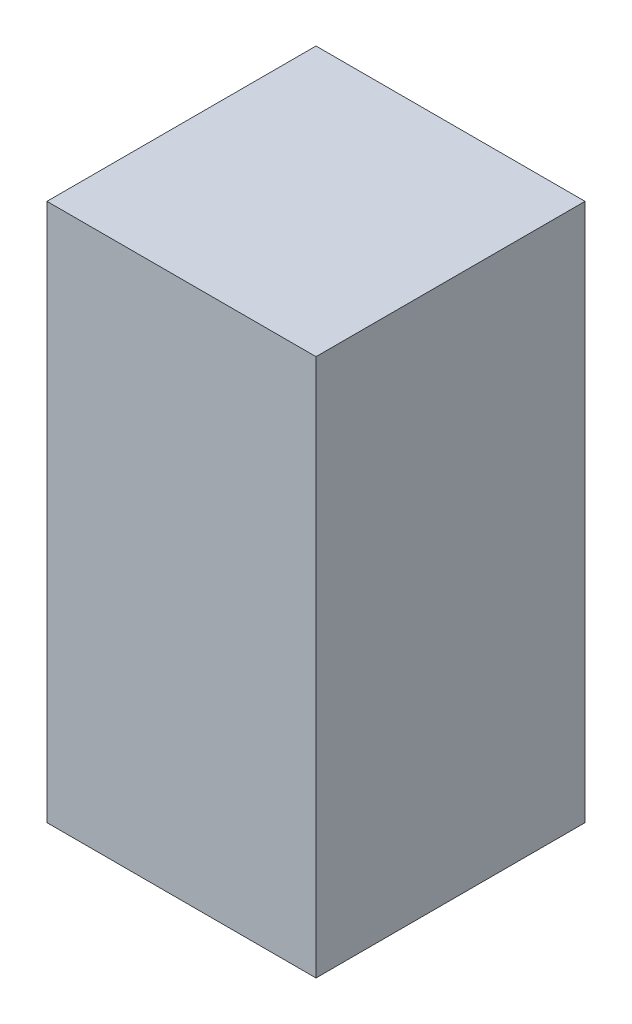
from build123d import *

# Parameters (mm, degrees)
SKETCH1_W           = 6.5
SKETCH1_H           = 6.5
BOSS_EXTRUDE1_DEPTH = 13


with BuildPart() as part:
    # Sketch1 → Boss-Extrude1 (new body)
    with BuildSketch(Plane(origin=(0, 0, 0), x_dir=(1, 0, 0), z_dir=(0, 1, 0))):
        Rectangle(SKETCH1_W, SKETCH1_H)
    extrude(amount=BOSS_EXTRUDE1_DEPTH)


solid = part.part
